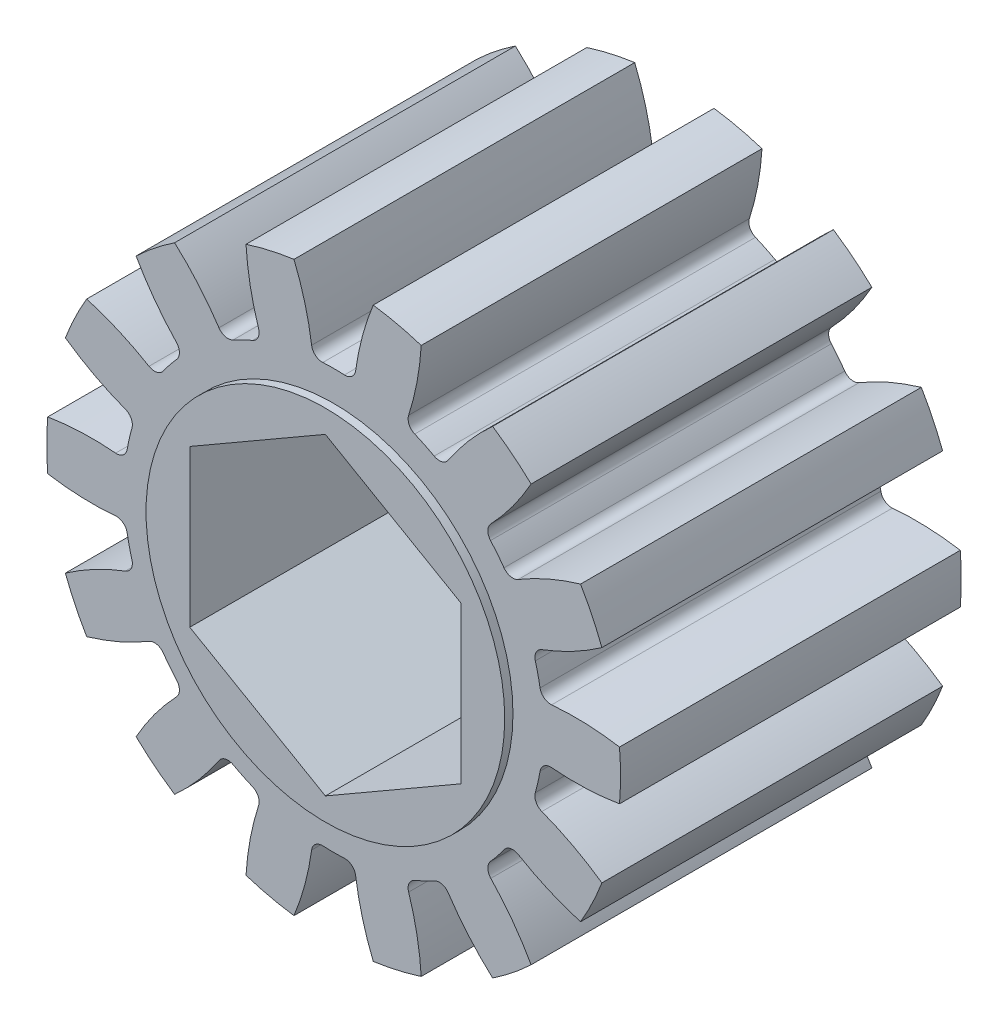
from build123d import *

# Parameters (mm, degrees)
CROQUIS1_R                 = 10.16
SALIENTE_EXTRUIR1_DEPTH    = 6.0325
CORTAR_EXTRUIR1_DEPTH      = 16.583396814
REDONDEO1_R                = 0.381028065
MATRIZC1_COUNT             = 14
REDONDEO1_OF_MATRIZC1_R    = 0.381028065
CROQUIS3_R                 = 6.35
SALIENTE_EXTRUIR2_DEPTH    = 6.3246
CORTAR_EXTRUIR2_DEPTH      = 16.635943497
CORTAR_EXTRUIR2_DEPTH_BACK = 16.635943497


with BuildPart() as part:
    # Croquis1 → Saliente-Extruir1 (new, symmetric)
    with BuildSketch(Plane.XY):
        Circle(CROQUIS1_R)
    extrude(amount=SALIENTE_EXTRUIR1_DEPTH, both=True)

    # Croquis2 → Cortar-Extruir1 (cut, symmetric)
    with BuildSketch(Plane.XY):
        with BuildLine():
            ThreePointArc((0.737043747, 7.383916257), (0, 7.42061), (-0.737043747, 7.383916257))
            ThreePointArc((-0.737043747, 7.383916257), (-0.973357597, 8.747341873), (-1.403224912, 10.062631855))
            ThreePointArc((-1.403224912, 10.062631855), (0, 10.16), (1.403224912, 10.062631855))
            ThreePointArc((1.403224912, 10.062631855), (0.973357597, 8.747341873), (0.737043747, 7.383916257))
        make_face()
    cortar_extruir1 = extrude(amount=CORTAR_EXTRUIR1_DEPTH, both=True, mode=Mode.SUBTRACT)

    # Redondeo1
    redondeo1_edges = [part.edges().sort_by_distance(p)[0] for p in [
        (0.737043747, 7.383916257, 0),
        (-0.737043747, 7.383916257, 0),
    ]]
    fillet(redondeo1_edges, radius=REDONDEO1_R)

    # MatrizC1: Cortar-Extruir1 ×14 about axis
    matrizc1_axis = Axis((0, 0, 6.0325), (0, 0, -1))
    for i in range(1, MATRIZC1_COUNT):
        add(cortar_extruir1.rotate(matrizc1_axis, i * 360 / MATRIZC1_COUNT), mode=Mode.SUBTRACT)

    # Redondeo1 of MatrizC1
    redondeo1_of_matrizc1_edges = [part.edges().sort_by_distance(p)[0] for p in [
        (3.867814665, 6.332887374, 0),
        (2.539707725, 6.972469967, 0),
        (6.232517453, 4.027552479, 0),
        (5.313438934, 5.180040489, 0),
        (7.362793723, 0.924511421, 0),
        (7.034778397, 2.361640463, 0),
        (7.034778397, -2.361640463, 0),
        (7.362793723, -0.924511421, 0),
        (5.313438934, -5.180040489, 0),
        (6.232517453, -4.027552479, 0),
        (2.539707725, -6.972469967, 0),
        (3.867814665, -6.332887374, 0),
        (-0.737043747, -7.383916257, 0),
        (0.737043747, -7.383916257, 0),
        (-3.867814665, -6.332887374, 0),
        (-2.539707725, -6.972469967, 0),
        (-6.232517453, -4.027552479, 0),
        (-5.313438934, -5.180040489, 0),
        (-7.362793723, -0.924511421, 0),
        (-7.034778397, -2.361640463, 0),
        (-7.034778397, 2.361640463, 0),
        (-7.362793723, 0.924511421, 0),
        (-5.313438934, 5.180040489, 0),
        (-6.232517453, 4.027552479, 0),
        (-2.539707725, 6.972469967, 0),
        (-3.867814665, 6.332887374, 0),
    ]]
    fillet(redondeo1_of_matrizc1_edges, radius=REDONDEO1_OF_MATRIZC1_R)

    # Croquis3 → Saliente-Extruir2 (add, symmetric)
    with BuildSketch(Plane.XY):
        Circle(CROQUIS3_R)
    extrude(amount=SALIENTE_EXTRUIR2_DEPTH, both=True)

    # Croquis4 → Cortar-Extruir2 (cut, two sides: drawn at the far end of the back side and taken through both)
    with BuildSketch(Plane.XY.offset(-CORTAR_EXTRUIR2_DEPTH_BACK)):
        Polygon((0, 5.543255405), (-4.8006, 2.771627702), (-4.8006, -2.771627702), (0, -5.543255405), (4.8006, -2.771627702), (4.8006, 2.771627702), align=None)
    extrude(amount=CORTAR_EXTRUIR2_DEPTH + CORTAR_EXTRUIR2_DEPTH_BACK, mode=Mode.SUBTRACT)


solid = part.part
